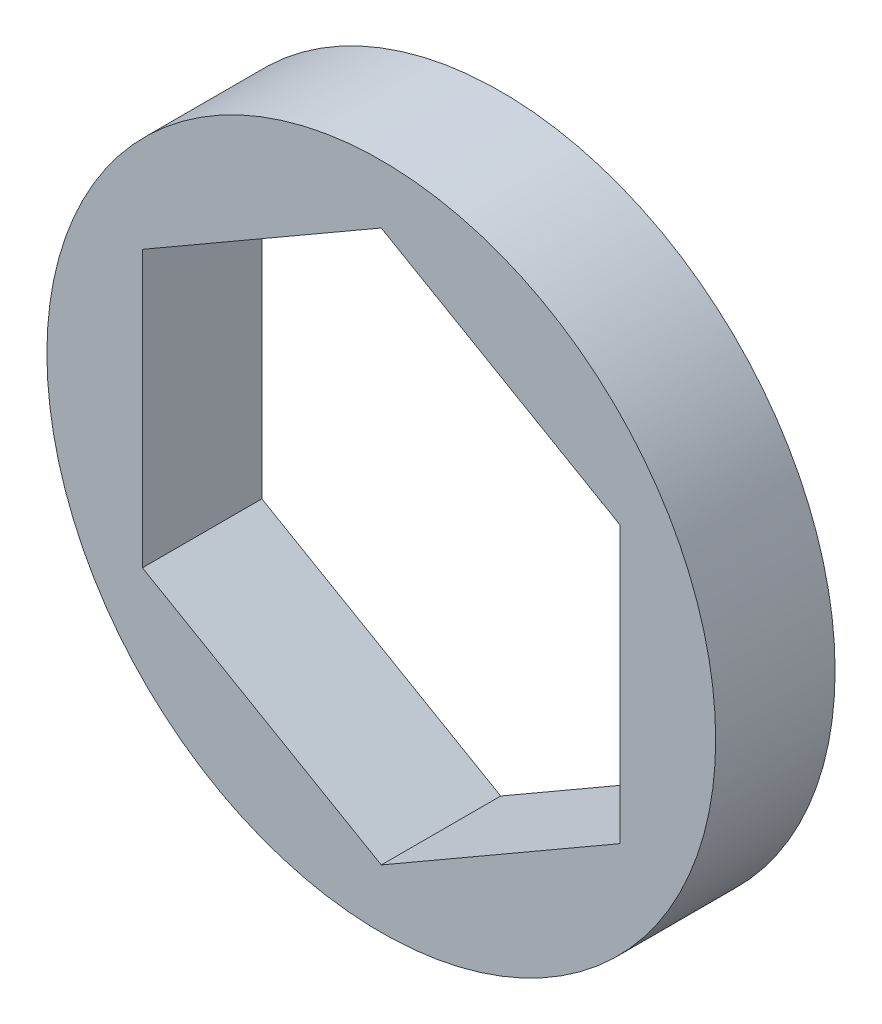
from build123d import *

# Parameters (mm, degrees)
SKETCH1_R           = 8.89
BOSS_EXTRUDE1_DEPTH = 1.5875


with BuildPart() as part:
    # Sketch1 → Boss-Extrude1 (new, symmetric)
    with BuildSketch(Plane.XY):
        Circle(SKETCH1_R)
        Polygon((0, 7.332348419), (-6.35, 3.666174209), (-6.35, -3.666174209), (0, -7.332348419), (6.35, -3.666174209), (6.35, 3.666174209), align=None, mode=Mode.SUBTRACT)
    extrude(amount=BOSS_EXTRUDE1_DEPTH, both=True)


solid = part.part
